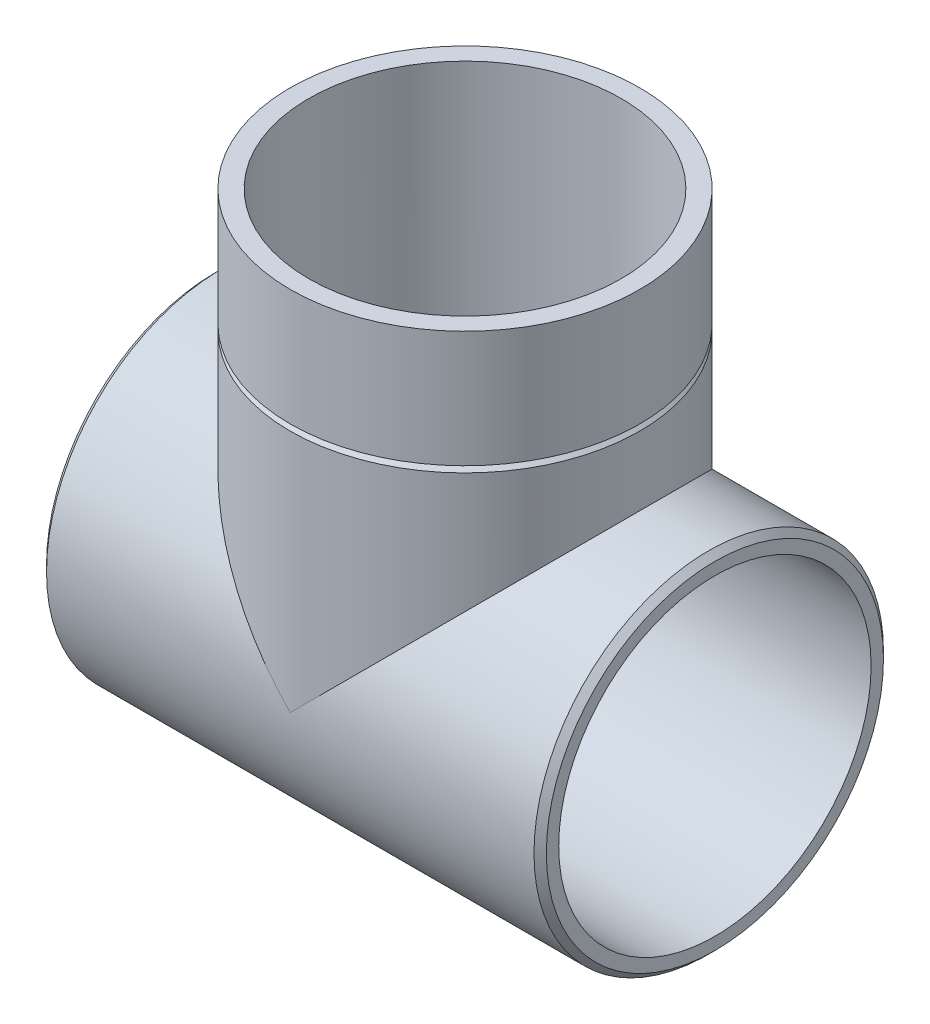
from build123d import *

# Parameters (mm, degrees)
RUNROUTE_R           = 17.9
RUNEXTRUDE_DEPTH     = 25.6
OUTLETROUTE_R        = 17.9
OUTLETEXTRUDE_DEPTH  = 25.6
TEESHELL_START       = -25.6
TEESHELL_OUTLINE_R   = 16
TEESHELL_DEPTH       = 51.2
TEESHELL_START_2     = -1e-07
TEESHELL_2_OUTLINE_R = 16
TEESHELL_2_DEPTH     = 25.6000001
TEECHAMFER_SIZE      = 0.633333333
SKETCH_1_R           = 17.9
SKETCH_1_R_2         = 16
EXTRUDE_1_DEPTH      = 11.933333333


with BuildPart() as part:
    # RunRoute → RunExtrude (new body)
    with BuildSketch(Plane(origin=(0, 0, 0), x_dir=(0, 0, -1), z_dir=(1, 0, 0))):
        Circle(RUNROUTE_R)
    runextrude = extrude(amount=RUNEXTRUDE_DEPTH)

    # RunExtrudeMirror: RunExtrude across plane
    add(runextrude.mirror(Plane(origin=(0, 0, 0), x_dir=(0, 0, 1), z_dir=(1, 0, 0))))

    # OutletRoute → OutletExtrude (add)
    with BuildSketch(Plane(origin=(0, 0, 0), x_dir=(1, 0, 0), z_dir=(0, 1, 0))):
        with Locations(Location((0, 0, 0), (0, 0, 270))):
            Circle(OUTLETROUTE_R)
    extrude(amount=OUTLETEXTRUDE_DEPTH)

    # TeeShell: read off the stored shape, not the designer's step
    # TeeShell outline → TeeShell (cut)
    with BuildSketch(Plane.YZ.offset(TEESHELL_START)):
        Circle(TEESHELL_OUTLINE_R)
    extrude(amount=TEESHELL_DEPTH, mode=Mode.SUBTRACT)

    # TeeShell 2 outline → TeeShell 2 (cut)
    with BuildSketch(Plane(origin=(0, 0, 0), x_dir=(1, 0, 0), z_dir=(0, 1, 0)).offset(TEESHELL_START_2)):
        Circle(TEESHELL_2_OUTLINE_R)
    extrude(amount=TEESHELL_2_DEPTH, mode=Mode.SUBTRACT)

    # TeeChamfer
    # the kernel refuses this chamfer: 0.633333333 mm, written as the material it takes off along each edge
    with BuildSketch(Plane(origin=(25.6, 0, 0), x_dir=(0, 0, -1), z_dir=(0, -1, 0))) as teechamfer_piece_1:
        Polygon((17.9, -TEECHAMFER_SIZE), (17.9 - TEECHAMFER_SIZE, 0), (17.9, 0), align=None)
    revolve(axis=Axis((25.6, 0, 0), (1, 0, 0)), mode=Mode.SUBTRACT)
    with BuildSketch(Plane(origin=(-25.6, 0, 0), x_dir=(0, 0, -1), z_dir=(0, -1, 0))) as teechamfer_piece_2:
        Polygon((17.9, TEECHAMFER_SIZE), (17.9 - TEECHAMFER_SIZE, 0), (17.9, 0), align=None)
    revolve(axis=Axis((-25.6, 0, 0), (1, 0, 0)), mode=Mode.SUBTRACT)
    with BuildSketch(Plane(origin=(0, 25.6, 0), x_dir=(0, 0, 1), z_dir=(-1, 0, 0))) as teechamfer_piece_3:
        Polygon((17.9, -TEECHAMFER_SIZE), (17.9 - TEECHAMFER_SIZE, 0), (17.9, 0), align=None)
    revolve(axis=Axis((0, 25.6, 0), (0, 1, 0)), mode=Mode.SUBTRACT)

    # Эскиз1 → Бобышка-Вытянуть1 (add)
    with BuildSketch(Plane(origin=(0, 25.6, 0), x_dir=(1, 0, 0), z_dir=(0, 1, 0))):
        with Locations(Location((0, 0, 0), (0, 0, 270))):
            Circle(SKETCH_1_R)
        with Locations(Location((0, 0, 0), (0, 0, 270))):
            Circle(SKETCH_1_R_2, mode=Mode.SUBTRACT)
    extrude(amount=EXTRUDE_1_DEPTH)


solid = part.part
